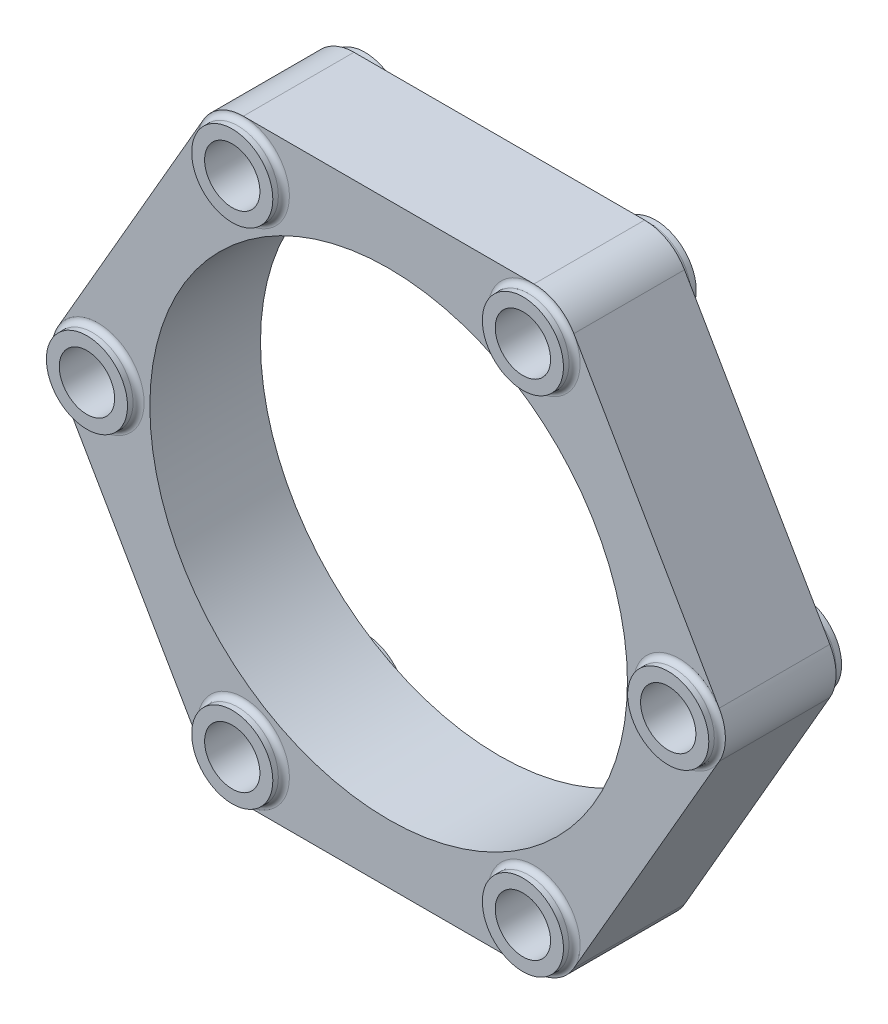
from build123d import *

# Parameters (mm, degrees)
SKETCH1_R           = 64.75
BOSS_EXTRUDE1_DEPTH = 15
SKETCH2_R           = 11
BOSS_EXTRUDE2_DEPTH = 18
CUT_EXTRUDE1_REACH  = 129.1
SKETCH4_R           = 7.5
FILLET1_R           = 1.5


with BuildPart() as part:
    # Sketch1 → Boss-Extrude1 (new, symmetric)
    with BuildSketch(Plane.XY):
        with BuildLine():
            Line((-89.635317547, 6.25), (-50.230317547, 74.501462072))
            ThreePointArc((-50.230317547, 74.501462072), (-45.655, 79.07677962), (-39.405, 80.751462072))
            Line((-39.405, 80.751462072), (39.405, 80.751462072))
            ThreePointArc((39.405, 80.751462072), (45.655, 79.07677962), (50.230317547, 74.501462072))
            Line((50.230317547, 74.501462072), (89.635317547, 6.25))
            ThreePointArc((89.635317547, 6.25), (91.31, 0), (89.635317547, -6.25))
            Line((89.635317547, -6.25), (50.230317547, -74.501462072))
            ThreePointArc((50.230317547, -74.501462072), (45.655, -79.07677962), (39.405, -80.751462072))
            Line((39.405, -80.751462072), (-39.405, -80.751462072))
            ThreePointArc((-39.405, -80.751462072), (-45.655, -79.07677962), (-50.230317547, -74.501462072))
            Line((-50.230317547, -74.501462072), (-89.635317547, -6.25))
            ThreePointArc((-89.635317547, -6.25), (-91.31, 0), (-89.635317547, 6.25))
        make_face()
        Circle(SKETCH1_R, mode=Mode.SUBTRACT)
    extrude(amount=BOSS_EXTRUDE1_DEPTH, both=True)

    # Sketch2 → Boss-Extrude2 (add, symmetric)
    with BuildSketch(Plane.XY):
        with Locations((-78.81, 0)):
            Circle(SKETCH2_R)
        with Locations((-39.405, 68.251462072)):
            Circle(SKETCH2_R)
        with Locations((39.405, 68.251462072)):
            Circle(SKETCH2_R)
        with Locations((78.81, 0)):
            Circle(SKETCH2_R)
        with Locations((39.405, -68.251462072)):
            Circle(SKETCH2_R)
        with Locations((-39.405, -68.251462072)):
            Circle(SKETCH2_R)
    extrude(amount=BOSS_EXTRUDE2_DEPTH, both=True)

    # Sketch4 → Cut-Extrude1 (cut, up to next)
    with BuildSketch(Plane.XY.offset(18), mode=Mode.PRIVATE) as cut_extrude1_sk1:
        with Locations((-78.81, 0)):
            Circle(SKETCH4_R)
    cut_extrude1_tool1 = extrude(cut_extrude1_sk1.sketch, amount=-CUT_EXTRUDE1_REACH, mode=Mode.PRIVATE) & part.part
    # Sketch4 → Cut-Extrude1 (cut, up to next)
    with BuildSketch(Plane.XY.offset(18), mode=Mode.PRIVATE) as cut_extrude1_sk2:
        with Locations((-39.405, 68.251462072)):
            Circle(SKETCH4_R)
    cut_extrude1_tool2 = extrude(cut_extrude1_sk2.sketch, amount=-CUT_EXTRUDE1_REACH, mode=Mode.PRIVATE) & part.part
    # Sketch4 → Cut-Extrude1 (cut, up to next)
    with BuildSketch(Plane.XY.offset(18), mode=Mode.PRIVATE) as cut_extrude1_sk3:
        with Locations((39.405, 68.251462072)):
            Circle(SKETCH4_R)
    cut_extrude1_tool3 = extrude(cut_extrude1_sk3.sketch, amount=-CUT_EXTRUDE1_REACH, mode=Mode.PRIVATE) & part.part
    # Sketch4 → Cut-Extrude1 (cut, up to next)
    with BuildSketch(Plane.XY.offset(18), mode=Mode.PRIVATE) as cut_extrude1_sk4:
        with Locations((78.81, 0)):
            Circle(SKETCH4_R)
    cut_extrude1_tool4 = extrude(cut_extrude1_sk4.sketch, amount=-CUT_EXTRUDE1_REACH, mode=Mode.PRIVATE) & part.part
    # Sketch4 → Cut-Extrude1 (cut, up to next)
    with BuildSketch(Plane.XY.offset(18), mode=Mode.PRIVATE) as cut_extrude1_sk5:
        with Locations((39.405, -68.251462072)):
            Circle(SKETCH4_R)
    cut_extrude1_tool5 = extrude(cut_extrude1_sk5.sketch, amount=-CUT_EXTRUDE1_REACH, mode=Mode.PRIVATE) & part.part
    # Sketch4 → Cut-Extrude1 (cut, up to next)
    with BuildSketch(Plane.XY.offset(18), mode=Mode.PRIVATE) as cut_extrude1_sk6:
        with Locations((-39.405, -68.251462072)):
            Circle(SKETCH4_R)
    cut_extrude1_tool6 = extrude(cut_extrude1_sk6.sketch, amount=-CUT_EXTRUDE1_REACH, mode=Mode.PRIVATE) & part.part
    add(cut_extrude1_tool1.solids().sort_by_distance((-78.81, 0, 18))[0], mode=Mode.SUBTRACT)
    add(cut_extrude1_tool2.solids().sort_by_distance((-39.405, 68.251462, 18))[0], mode=Mode.SUBTRACT)
    add(cut_extrude1_tool3.solids().sort_by_distance((39.405, 68.251462, 18))[0], mode=Mode.SUBTRACT)
    add(cut_extrude1_tool4.solids().sort_by_distance((78.81, 0, 18))[0], mode=Mode.SUBTRACT)
    add(cut_extrude1_tool5.solids().sort_by_distance((39.405, -68.251462, 18))[0], mode=Mode.SUBTRACT)
    add(cut_extrude1_tool6.solids().sort_by_distance((-39.405, -68.251462, 18))[0], mode=Mode.SUBTRACT)

    # Fillet1
    fillet1_edges = [part.edges().sort_by_distance(p)[0] for p in [
        (-89.81, 0, -15),
        (-89.81, 0, 15),
        (-50.405, 68.251462072, -15),
        (-50.405, 68.251462072, 15),
        (28.405, 68.251462072, -15),
        (28.405, 68.251462072, 15),
        (67.81, 0, -15),
        (67.81, 0, 15),
        (28.405, -68.251462072, -15),
        (28.405, -68.251462072, 15),
        (-50.405, -68.251462072, -15),
        (-50.405, -68.251462072, 15),
    ]]
    fillet(fillet1_edges, radius=FILLET1_R - 0.0001)  # a hair under: the kernel refuses the full size


solid = part.part
